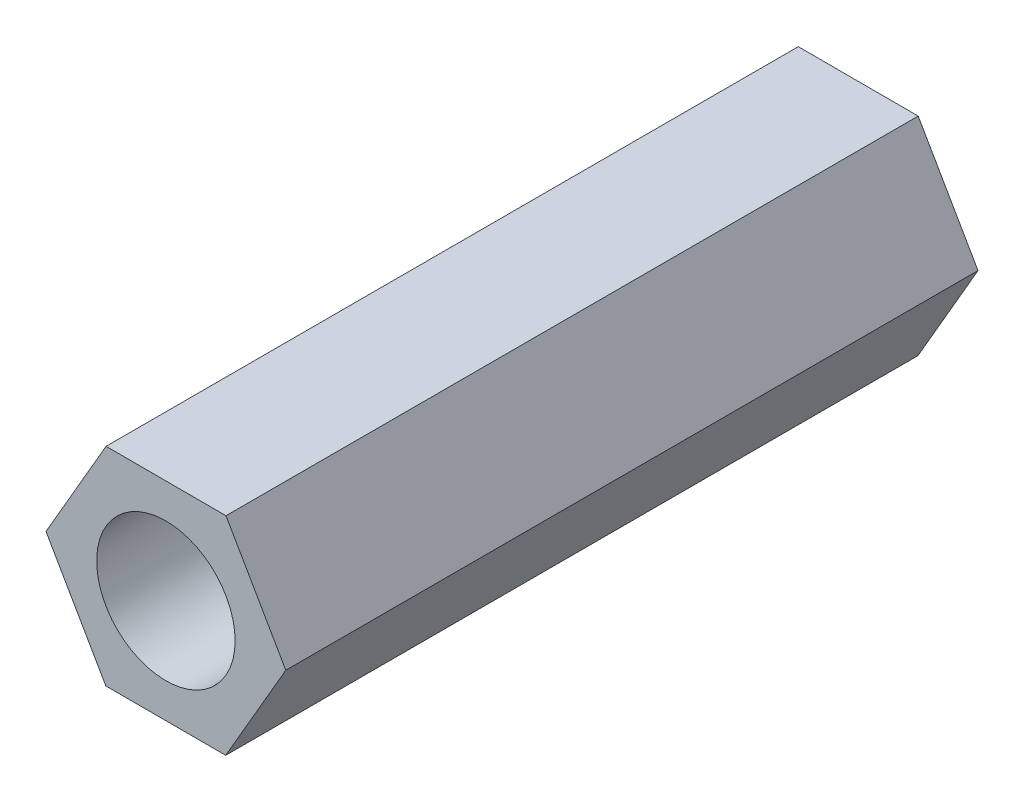
from build123d import *

# Parameters (mm, degrees)
SKETCH2_R           = 2
BOSS_EXTRUDE1_DEPTH = 20


with BuildPart() as part:
    # Sketch2 → Boss-Extrude1 (new body)
    with BuildSketch(Plane.XY):
        Polygon((-1.7278037, 3.002448064), (-3.464098147, 0.004902135), (-1.736294447, -2.997545929), (1.7278037, -3.002448064), (3.464098147, -0.004902135), (1.736294447, 2.997545929), align=None)
        Circle(SKETCH2_R, mode=Mode.SUBTRACT)
    extrude(amount=BOSS_EXTRUDE1_DEPTH)


solid = part.part
